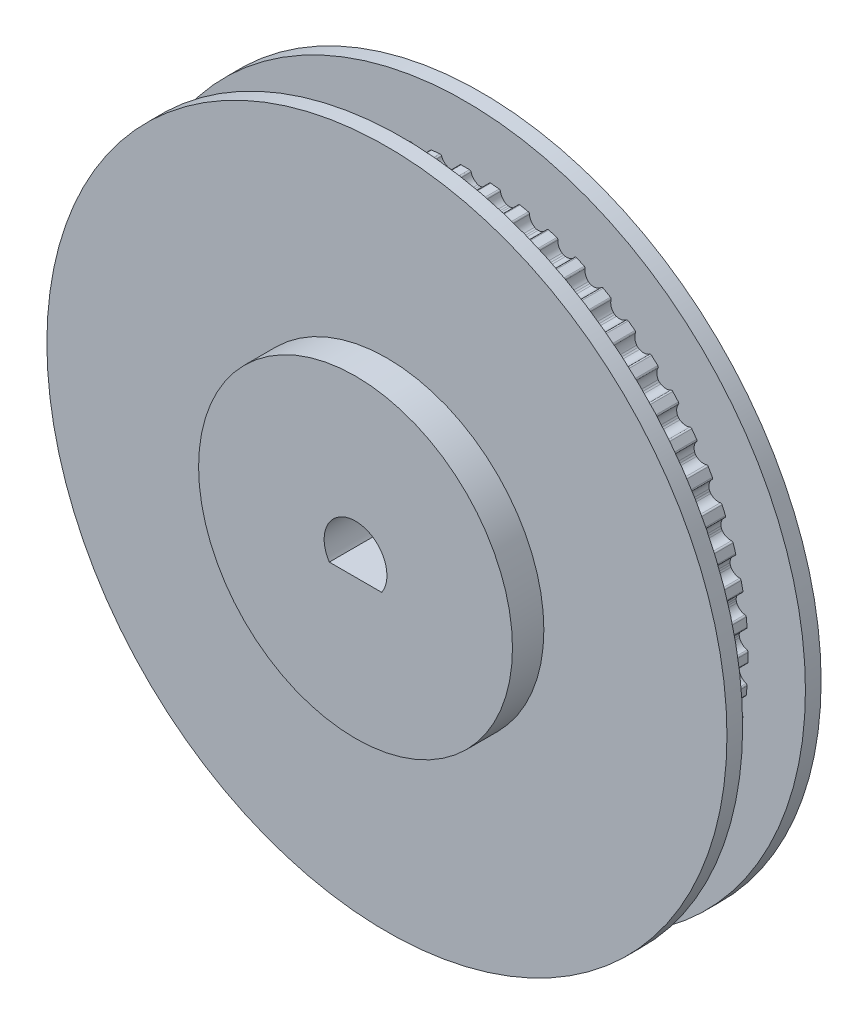
from build123d import *

# Parameters (mm, degrees)
SKETCH2_R           = 27.695
BOSS_EXTRUDE1_DEPTH = 3
SKETCH3_R           = 27.695
CUT_EXTRUDE5_DEPTH  = 40.623554232
SKETCH4_R           = 32.5
BOSS_EXTRUDE2_DEPTH = 1.5
BOSS_EXTRUDE3_START = 1.5
SKETCH5_R           = 32.5
BOSS_EXTRUDE3_DEPTH = 1.5
SKETCH6_R           = 15
BOSS_EXTRUDE4_DEPTH = 3
CUT_EXTRUDE6_DEPTH  = 48.502631506
CUT_EXTRUDE7_REACH  = 75.058
SKETCH8_R           = 1.5


with BuildPart() as part:
    # Sketch2 → Boss-Extrude1 (new, symmetric)
    with BuildSketch(Plane.XY):
        Circle(SKETCH2_R)
    extrude(amount=BOSS_EXTRUDE1_DEPTH, both=True)

    # Sketch3 → Cut-Extrude5 (cut, through all)
    with BuildSketch(Plane.XY.offset(3)):
        Circle(SKETCH3_R)
        with BuildLine():
            Line((2.427877919, 26.926424266), (3.223495435, 26.842801495))
            ThreePointArc((3.223495435, 26.842801495), (3.312543817, 26.801010915), (3.356554343, 26.713038531))
            ThreePointArc((3.356554343, 26.713038531), (3.543312083, 26.248968735), (3.931469889, 25.933417238))
            ThreePointArc((3.931469889, 25.933417238), (4.013941141, 25.903512456), (4.100094244, 25.886976241))
            ThreePointArc((4.100094244, 25.886976241), (4.187140685, 25.876080343), (4.274816593, 25.879036463))
            ThreePointArc((4.274816593, 25.879036463), (4.741487378, 26.059196411), (5.062509997, 26.442841699))
            ThreePointArc((5.062509997, 26.442841699), (5.131551457, 26.512908409), (5.2291555, 26.525136148))
            Line((5.2291555, 26.525136148), (6.01167358, 26.358806796))
            ThreePointArc((6.01167358, 26.358806796), (6.09586584, 26.307937059), (6.130439654, 26.215846244))
            ThreePointArc((6.130439654, 26.215846244), (6.267665813, 25.734797171), (6.620713136, 25.380400759))
            ThreePointArc((6.620713136, 25.380400759), (6.699606702, 25.342039205), (6.783559343, 25.316588126))
            ThreePointArc((6.783559343, 25.316588126), (6.868990004, 25.296653086), (6.956494612, 25.290428384))
            ThreePointArc((6.956494612, 25.290428384), (7.439440769, 25.420821017), (7.798806645, 25.768808656))
            ThreePointArc((7.798806645, 25.768808656), (7.874793854, 25.831274734), (7.973141358, 25.833233089))
            Line((7.973141358, 25.833233089), (8.733986571, 25.586019493))
            ThreePointArc((8.733986571, 25.586019493), (8.812400282, 25.526627938), (8.837158585, 25.431427659))
            ThreePointArc((8.837158585, 25.431427659), (8.923349684, 24.938669783), (9.237418465, 24.549311298))
            ThreePointArc((9.237418465, 24.549311298), (9.311869969, 24.50291327), (9.392702348, 24.468826174))
            ThreePointArc((9.392702348, 24.468826174), (9.47558123, 24.440070404), (9.561955821, 24.424733079))
            ThreePointArc((9.561955821, 24.424733079), (10.05588609, 24.503929789), (10.449657935, 24.812447152))
            ThreePointArc((10.449657935, 24.812447152), (10.531758361, 24.866628208), (10.629771812, 24.858295721))
            Line((10.629771812, 24.858295721), (11.360608178, 24.532906407))
            ThreePointArc((11.360608178, 24.532906407), (11.432384222, 24.46564374), (11.447055758, 24.36837703))
            ThreePointArc((11.447055758, 24.36837703), (11.48126747, 23.869309111), (11.752916705, 23.449254446))
            ThreePointArc((11.752916705, 23.449254446), (11.822110441, 23.395328289), (11.898936939, 23.352978641))
            ThreePointArc((11.898936939, 23.352978641), (11.978356007, 23.315717197), (12.062654241, 23.291435288))
            ThreePointArc((12.062654241, 23.291435288), (12.562157019, 23.318568378), (12.986020586, 23.584235284))
            ThreePointArc((12.986020586, 23.584235284), (13.07333472, 23.6295377), (13.169940261, 23.611005664))
            Line((13.169940261, 23.611005664), (13.862760584, 23.211005664))
            ThreePointArc((13.862760584, 23.211005664), (13.927112568, 23.13660883), (13.931536592, 23.038341364))
            ThreePointArc((13.931536592, 23.038341364), (13.913394086, 22.538431294), (14.139647529, 22.092282654))
            ThreePointArc((14.139647529, 22.092282654), (14.202825397, 22.031419196), (14.274804288, 21.981270988))
            ThreePointArc((14.274804288, 21.981270988), (14.349893408, 21.935912113), (14.431191697, 21.902951658))
            ThreePointArc((14.431191697, 21.902951658), (14.930794326, 21.877723852), (15.380105678, 22.0976296))
            ThreePointArc((15.380105678, 22.0976296), (15.471676888, 22.133557032), (15.565816088, 22.105028488))
            Line((15.565816088, 22.105028488), (16.213029684, 21.634800286))
            ThreePointArc((16.213029684, 21.634800286), (16.269252554, 21.554084391), (16.263380596, 21.455892809))
            ThreePointArc((16.263380596, 21.455892809), (16.193082645, 20.960617706), (16.371461417, 20.493263191))
            ThreePointArc((16.371461417, 20.493263191), (16.427931225, 20.426129263), (16.494273893, 20.36873193))
            ThreePointArc((16.494273893, 20.36873193), (16.564210374, 20.315772585), (16.641617997, 20.274494706))
            ThreePointArc((16.641617997, 20.274494706), (17.135846727, 20.197182405), (17.605683114, 20.368917661))
            ThreePointArc((17.605683114, 20.368917661), (17.700508127, 20.395076482), (17.791149577, 20.356863994))
            Line((17.791149577, 20.356863994), (18.385665438, 19.821559509))
            ThreePointArc((18.385665438, 19.821559509), (18.433143205, 19.735408894), (18.417039599, 19.638369002))
            ThreePointArc((18.417039599, 19.638369002), (18.295356402, 19.153155205), (18.423906147, 18.669715248))
            ThreePointArc((18.423906147, 18.669715248), (18.473049201, 18.597046384), (18.533028782, 18.533028782))
            ThreePointArc((18.533028782, 18.533028782), (18.597046384, 18.473049201), (18.669715248, 18.423906147))
            ThreePointArc((18.669715248, 18.423906147), (19.153155205, 18.295356402), (19.638369002, 18.417039599))
            ThreePointArc((19.638369002, 18.417039599), (19.735408894, 18.433143205), (19.821559509, 18.385665438))
            Line((19.821559509, 18.385665438), (20.356863994, 17.791149577))
            ThreePointArc((20.356863994, 17.791149577), (20.395076482, 17.700508127), (20.368917661, 17.605683114))
            ThreePointArc((20.368917661, 17.605683114), (20.197182405, 17.135846727), (20.274494706, 16.641617997))
            ThreePointArc((20.274494706, 16.641617997), (20.315772585, 16.564210374), (20.36873193, 16.494273893))
            ThreePointArc((20.36873193, 16.494273893), (20.426129263, 16.427931225), (20.493263191, 16.371461417))
            ThreePointArc((20.493263191, 16.371461417), (20.960617706, 16.193082645), (21.455892809, 16.263380596))
            ThreePointArc((21.455892809, 16.263380596), (21.554084391, 16.269252554), (21.634800286, 16.213029684))
            Line((21.634800286, 16.213029684), (22.105028488, 15.565816088))
            ThreePointArc((22.105028488, 15.565816088), (22.133557032, 15.471676888), (22.0976296, 15.380105678))
            ThreePointArc((22.0976296, 15.380105678), (21.877723852, 14.930794326), (21.902951658, 14.431191697))
            ThreePointArc((21.902951658, 14.431191697), (21.935912113, 14.349893408), (21.981270988, 14.274804288))
            ThreePointArc((21.981270988, 14.274804288), (22.031419196, 14.202825397), (22.092282654, 14.139647529))
            ThreePointArc((22.092282654, 14.139647529), (22.538431294, 13.913394086), (23.038341364, 13.931536592))
            ThreePointArc((23.038341364, 13.931536592), (23.13660883, 13.927112568), (23.211005664, 13.862760584))
            Line((23.211005664, 13.862760584), (23.611005664, 13.169940261))
            ThreePointArc((23.611005664, 13.169940261), (23.6295377, 13.07333472), (23.584235284, 12.986020586))
            ThreePointArc((23.584235284, 12.986020586), (23.318568378, 12.562157019), (23.291435288, 12.062654241))
            ThreePointArc((23.291435288, 12.062654241), (23.315717197, 11.978356007), (23.352978641, 11.898936939))
            ThreePointArc((23.352978641, 11.898936939), (23.395328289, 11.822110441), (23.449254446, 11.752916705))
            ThreePointArc((23.449254446, 11.752916705), (23.869309111, 11.48126747), (24.36837703, 11.447055758))
            ThreePointArc((24.36837703, 11.447055758), (24.46564374, 11.432384222), (24.532906407, 11.360608178))
            Line((24.532906407, 11.360608178), (24.858295721, 10.629771812))
            ThreePointArc((24.858295721, 10.629771812), (24.866628208, 10.531758361), (24.812447152, 10.449657935))
            ThreePointArc((24.812447152, 10.449657935), (24.503929789, 10.05588609), (24.424733079, 9.561955821))
            ThreePointArc((24.424733079, 9.561955821), (24.440070404, 9.47558123), (24.468826174, 9.392702348))
            ThreePointArc((24.468826174, 9.392702348), (24.50291327, 9.311869969), (24.549311298, 9.237418465))
            ThreePointArc((24.549311298, 9.237418465), (24.938669783, 8.923349684), (25.431427659, 8.837158585))
            ThreePointArc((25.431427659, 8.837158585), (25.526627938, 8.812400282), (25.586019493, 8.733986571))
            Line((25.586019493, 8.733986571), (25.833233089, 7.973141358))
            ThreePointArc((25.833233089, 7.973141358), (25.831274734, 7.874793854), (25.768808656, 7.798806645))
            ThreePointArc((25.768808656, 7.798806645), (25.420821017, 7.439440769), (25.290428384, 6.956494612))
            ThreePointArc((25.290428384, 6.956494612), (25.296653086, 6.868990004), (25.316588126, 6.783559343))
            ThreePointArc((25.316588126, 6.783559343), (25.342039205, 6.699606702), (25.380400759, 6.620713136))
            ThreePointArc((25.380400759, 6.620713136), (25.734797171, 6.267665813), (26.215846244, 6.130439654))
            ThreePointArc((26.215846244, 6.130439654), (26.307937059, 6.09586584), (26.358806796, 6.01167358))
            Line((26.358806796, 6.01167358), (26.525136148, 5.2291555))
            ThreePointArc((26.525136148, 5.2291555), (26.512908409, 5.131551457), (26.442841699, 5.062509997))
            ThreePointArc((26.442841699, 5.062509997), (26.059196411, 4.741487378), (25.879036463, 4.274816593))
            ThreePointArc((25.879036463, 4.274816593), (25.876080343, 4.187140685), (25.886976241, 4.100094244))
            ThreePointArc((25.886976241, 4.100094244), (25.903512456, 4.013941141), (25.933417238, 3.931469889))
            ThreePointArc((25.933417238, 3.931469889), (26.248968735, 3.543312083), (26.713038531, 3.356554343))
            ThreePointArc((26.713038531, 3.356554343), (26.801010915, 3.312543817), (26.842801495, 3.223495435))
            Line((26.842801495, 3.223495435), (26.926424266, 2.427877919))
            ThreePointArc((26.926424266, 2.427877919), (26.90406111, 2.332086708), (26.827161436, 2.27074743))
            ThreePointArc((26.827161436, 2.27074743), (26.412061796, 1.991585259), (26.184108402, 1.546302788))
            ThreePointArc((26.184108402, 1.546302788), (26.172003849, 1.459416176), (26.173741227, 1.371707653))
            ThreePointArc((26.173741227, 1.371707653), (26.181181403, 1.284298001), (26.202301771, 1.199152634))
            ThreePointArc((26.202301771, 1.199152634), (26.475551105, 0.780137084), (26.917557178, 0.54589392))
            ThreePointArc((26.917557178, 0.54589392), (27.000447288, 0.49292887), (27.032700844, 0.4))
            Line((27.032700844, 0.4), (27.032700844, -0.4))
            ThreePointArc((27.032700844, -0.4), (27.000447288, -0.49292887), (26.917557178, -0.54589392))
            ThreePointArc((26.917557178, -0.54589392), (26.475551105, -0.780137084), (26.202301771, -1.199152634))
            ThreePointArc((26.202301771, -1.199152634), (26.181181403, -1.284298001), (26.173741227, -1.371707653))
            ThreePointArc((26.173741227, -1.371707653), (26.172003849, -1.459416176), (26.184108402, -1.546302788))
            ThreePointArc((26.184108402, -1.546302788), (26.412061796, -1.991585259), (26.827161436, -2.27074743))
            ThreePointArc((26.827161436, -2.27074743), (26.90406111, -2.332086708), (26.926424266, -2.427877919))
            Line((26.926424266, -2.427877919), (26.842801495, -3.223495435))
            ThreePointArc((26.842801495, -3.223495435), (26.801010915, -3.312543817), (26.713038531, -3.356554343))
            ThreePointArc((26.713038531, -3.356554343), (26.248968735, -3.543312083), (25.933417238, -3.931469889))
            ThreePointArc((25.933417238, -3.931469889), (25.903512456, -4.013941141), (25.886976241, -4.100094244))
            ThreePointArc((25.886976241, -4.100094244), (25.876080343, -4.187140685), (25.879036463, -4.274816593))
            ThreePointArc((25.879036463, -4.274816593), (26.059196411, -4.741487378), (26.442841699, -5.062509997))
            ThreePointArc((26.442841699, -5.062509997), (26.512908409, -5.131551457), (26.525136148, -5.2291555))
            Line((26.525136148, -5.2291555), (26.358806796, -6.01167358))
            ThreePointArc((26.358806796, -6.01167358), (26.307937059, -6.09586584), (26.215846244, -6.130439654))
            ThreePointArc((26.215846244, -6.130439654), (25.734797171, -6.267665813), (25.380400759, -6.620713136))
            ThreePointArc((25.380400759, -6.620713136), (25.342039205, -6.699606702), (25.316588126, -6.783559343))
            ThreePointArc((25.316588126, -6.783559343), (25.296653086, -6.868990004), (25.290428384, -6.956494612))
            ThreePointArc((25.290428384, -6.956494612), (25.420821017, -7.439440769), (25.768808656, -7.798806645))
            ThreePointArc((25.768808656, -7.798806645), (25.831274734, -7.874793854), (25.833233089, -7.973141358))
            Line((25.833233089, -7.973141358), (25.586019493, -8.733986571))
            ThreePointArc((25.586019493, -8.733986571), (25.526627938, -8.812400282), (25.431427659, -8.837158585))
            ThreePointArc((25.431427659, -8.837158585), (24.938669783, -8.923349684), (24.549311298, -9.237418465))
            ThreePointArc((24.549311298, -9.237418465), (24.50291327, -9.311869969), (24.468826174, -9.392702348))
            ThreePointArc((24.468826174, -9.392702348), (24.440070404, -9.47558123), (24.424733079, -9.561955821))
            ThreePointArc((24.424733079, -9.561955821), (24.503929789, -10.05588609), (24.812447152, -10.449657935))
            ThreePointArc((24.812447152, -10.449657935), (24.866628208, -10.531758361), (24.858295721, -10.629771812))
            Line((24.858295721, -10.629771812), (24.532906407, -11.360608178))
            ThreePointArc((24.532906407, -11.360608178), (24.46564374, -11.432384222), (24.36837703, -11.447055758))
            ThreePointArc((24.36837703, -11.447055758), (23.869309111, -11.48126747), (23.449254446, -11.752916705))
            ThreePointArc((23.449254446, -11.752916705), (23.395328289, -11.822110441), (23.352978641, -11.898936939))
            ThreePointArc((23.352978641, -11.898936939), (23.315717197, -11.978356007), (23.291435288, -12.062654241))
            ThreePointArc((23.291435288, -12.062654241), (23.318568378, -12.562157019), (23.584235284, -12.986020586))
            ThreePointArc((23.584235284, -12.986020586), (23.6295377, -13.07333472), (23.611005664, -13.169940261))
            Line((23.611005664, -13.169940261), (23.211005664, -13.862760584))
            ThreePointArc((23.211005664, -13.862760584), (23.13660883, -13.927112568), (23.038341364, -13.931536592))
            ThreePointArc((23.038341364, -13.931536592), (22.538431294, -13.913394086), (22.092282654, -14.139647529))
            ThreePointArc((22.092282654, -14.139647529), (22.031419196, -14.202825397), (21.981270988, -14.274804288))
            ThreePointArc((21.981270988, -14.274804288), (21.935912113, -14.349893408), (21.902951658, -14.431191697))
            ThreePointArc((21.902951658, -14.431191697), (21.877723852, -14.930794326), (22.0976296, -15.380105678))
            ThreePointArc((22.0976296, -15.380105678), (22.133557032, -15.471676888), (22.105028488, -15.565816088))
            Line((22.105028488, -15.565816088), (21.634800286, -16.213029684))
            ThreePointArc((21.634800286, -16.213029684), (21.554084391, -16.269252554), (21.455892809, -16.263380596))
            ThreePointArc((21.455892809, -16.263380596), (20.960617706, -16.193082645), (20.493263191, -16.371461417))
            ThreePointArc((20.493263191, -16.371461417), (20.426129263, -16.427931225), (20.36873193, -16.494273893))
            ThreePointArc((20.36873193, -16.494273893), (20.315772585, -16.564210374), (20.274494706, -16.641617997))
            ThreePointArc((20.274494706, -16.641617997), (20.197182405, -17.135846727), (20.368917661, -17.605683114))
            ThreePointArc((20.368917661, -17.605683114), (20.395076482, -17.700508127), (20.356863994, -17.791149577))
            Line((20.356863994, -17.791149577), (19.821559509, -18.385665438))
            ThreePointArc((19.821559509, -18.385665438), (19.735408894, -18.433143205), (19.638369002, -18.417039599))
            ThreePointArc((19.638369002, -18.417039599), (19.153155205, -18.295356402), (18.669715248, -18.423906147))
            ThreePointArc((18.669715248, -18.423906147), (18.597046384, -18.473049201), (18.533028782, -18.533028782))
            ThreePointArc((18.533028782, -18.533028782), (18.473049201, -18.597046384), (18.423906147, -18.669715248))
            ThreePointArc((18.423906147, -18.669715248), (18.295356402, -19.153155205), (18.417039599, -19.638369002))
            ThreePointArc((18.417039599, -19.638369002), (18.433143205, -19.735408894), (18.385665438, -19.821559509))
            Line((18.385665438, -19.821559509), (17.791149577, -20.356863994))
            ThreePointArc((17.791149577, -20.356863994), (17.700508127, -20.395076482), (17.605683114, -20.368917661))
            ThreePointArc((17.605683114, -20.368917661), (17.135846727, -20.197182405), (16.641617997, -20.274494706))
            ThreePointArc((16.641617997, -20.274494706), (16.564210374, -20.315772585), (16.494273893, -20.36873193))
            ThreePointArc((16.494273893, -20.36873193), (16.427931225, -20.426129263), (16.371461417, -20.493263191))
            ThreePointArc((16.371461417, -20.493263191), (16.193082645, -20.960617706), (16.263380596, -21.455892809))
            ThreePointArc((16.263380596, -21.455892809), (16.269252554, -21.554084391), (16.213029684, -21.634800286))
            Line((16.213029684, -21.634800286), (15.565816088, -22.105028488))
            ThreePointArc((15.565816088, -22.105028488), (15.471676888, -22.133557032), (15.380105678, -22.0976296))
            ThreePointArc((15.380105678, -22.0976296), (14.930794326, -21.877723852), (14.431191697, -21.902951658))
            ThreePointArc((14.431191697, -21.902951658), (14.349893408, -21.935912113), (14.274804288, -21.981270988))
            ThreePointArc((14.274804288, -21.981270988), (14.202825397, -22.031419196), (14.139647529, -22.092282654))
            ThreePointArc((14.139647529, -22.092282654), (13.913394086, -22.538431294), (13.931536592, -23.038341364))
            ThreePointArc((13.931536592, -23.038341364), (13.927112568, -23.13660883), (13.862760584, -23.211005664))
            Line((13.862760584, -23.211005664), (13.169940261, -23.611005664))
            ThreePointArc((13.169940261, -23.611005664), (13.07333472, -23.6295377), (12.986020586, -23.584235284))
            ThreePointArc((12.986020586, -23.584235284), (12.562157019, -23.318568378), (12.062654241, -23.291435288))
            ThreePointArc((12.062654241, -23.291435288), (11.978356007, -23.315717197), (11.898936939, -23.352978641))
            ThreePointArc((11.898936939, -23.352978641), (11.822110441, -23.395328289), (11.752916705, -23.449254446))
            ThreePointArc((11.752916705, -23.449254446), (11.48126747, -23.869309111), (11.447055758, -24.36837703))
            ThreePointArc((11.447055758, -24.36837703), (11.432384222, -24.46564374), (11.360608178, -24.532906407))
            Line((11.360608178, -24.532906407), (10.629771812, -24.858295721))
            ThreePointArc((10.629771812, -24.858295721), (10.531758361, -24.866628208), (10.449657935, -24.812447152))
            ThreePointArc((10.449657935, -24.812447152), (10.05588609, -24.503929789), (9.561955821, -24.424733079))
            ThreePointArc((9.561955821, -24.424733079), (9.47558123, -24.440070404), (9.392702348, -24.468826174))
            ThreePointArc((9.392702348, -24.468826174), (9.311869969, -24.50291327), (9.237418465, -24.549311298))
            ThreePointArc((9.237418465, -24.549311298), (8.923349684, -24.938669783), (8.837158585, -25.431427659))
            ThreePointArc((8.837158585, -25.431427659), (8.812400282, -25.526627938), (8.733986571, -25.586019493))
            Line((8.733986571, -25.586019493), (7.973141358, -25.833233089))
            ThreePointArc((7.973141358, -25.833233089), (7.874793854, -25.831274734), (7.798806645, -25.768808656))
            ThreePointArc((7.798806645, -25.768808656), (7.439440769, -25.420821017), (6.956494612, -25.290428384))
            ThreePointArc((6.956494612, -25.290428384), (6.868990004, -25.296653086), (6.783559343, -25.316588126))
            ThreePointArc((6.783559343, -25.316588126), (6.699606702, -25.342039205), (6.620713136, -25.380400759))
            ThreePointArc((6.620713136, -25.380400759), (6.267665813, -25.734797171), (6.130439654, -26.215846244))
            ThreePointArc((6.130439654, -26.215846244), (6.09586584, -26.307937059), (6.01167358, -26.358806796))
            Line((6.01167358, -26.358806796), (5.2291555, -26.525136148))
            ThreePointArc((5.2291555, -26.525136148), (5.131551457, -26.512908409), (5.062509997, -26.442841699))
            ThreePointArc((5.062509997, -26.442841699), (4.741487378, -26.059196411), (4.274816593, -25.879036463))
            ThreePointArc((4.274816593, -25.879036463), (4.187140685, -25.876080343), (4.100094244, -25.886976241))
            ThreePointArc((4.100094244, -25.886976241), (4.013941141, -25.903512456), (3.931469889, -25.933417238))
            ThreePointArc((3.931469889, -25.933417238), (3.543312083, -26.248968735), (3.356554343, -26.713038531))
            ThreePointArc((3.356554343, -26.713038531), (3.312543817, -26.801010915), (3.223495435, -26.842801495))
            Line((3.223495435, -26.842801495), (2.427877919, -26.926424266))
            ThreePointArc((2.427877919, -26.926424266), (2.332086708, -26.90406111), (2.27074743, -26.827161436))
            ThreePointArc((2.27074743, -26.827161436), (1.991585259, -26.412061796), (1.546302788, -26.184108402))
            ThreePointArc((1.546302788, -26.184108402), (1.459416176, -26.172003849), (1.371707653, -26.173741227))
            ThreePointArc((1.371707653, -26.173741227), (1.284298001, -26.181181403), (1.199152634, -26.202301771))
            ThreePointArc((1.199152634, -26.202301771), (0.780137084, -26.475551105), (0.54589392, -26.917557178))
            ThreePointArc((0.54589392, -26.917557178), (0.49292887, -27.000447288), (0.4, -27.032700844))
            Line((0.4, -27.032700844), (-0.4, -27.032700844))
            ThreePointArc((-0.4, -27.032700844), (-0.49292887, -27.000447288), (-0.54589392, -26.917557178))
            ThreePointArc((-0.54589392, -26.917557178), (-0.780137084, -26.475551105), (-1.199152634, -26.202301771))
            ThreePointArc((-1.199152634, -26.202301771), (-1.284298001, -26.181181403), (-1.371707653, -26.173741227))
            ThreePointArc((-1.371707653, -26.173741227), (-1.459416176, -26.172003849), (-1.546302788, -26.184108402))
            ThreePointArc((-1.546302788, -26.184108402), (-1.991585259, -26.412061796), (-2.27074743, -26.827161436))
            ThreePointArc((-2.27074743, -26.827161436), (-2.332086708, -26.90406111), (-2.427877919, -26.926424266))
            Line((-2.427877919, -26.926424266), (-3.223495435, -26.842801495))
            ThreePointArc((-3.223495435, -26.842801495), (-3.312543817, -26.801010915), (-3.356554343, -26.713038531))
            ThreePointArc((-3.356554343, -26.713038531), (-3.543312083, -26.248968735), (-3.931469889, -25.933417238))
            ThreePointArc((-3.931469889, -25.933417238), (-4.013941141, -25.903512456), (-4.100094244, -25.886976241))
            ThreePointArc((-4.100094244, -25.886976241), (-4.187140685, -25.876080343), (-4.274816593, -25.879036463))
            ThreePointArc((-4.274816593, -25.879036463), (-4.741487378, -26.059196411), (-5.062509997, -26.442841699))
            ThreePointArc((-5.062509997, -26.442841699), (-5.131551457, -26.512908409), (-5.2291555, -26.525136148))
            Line((-5.2291555, -26.525136148), (-6.01167358, -26.358806796))
            ThreePointArc((-6.01167358, -26.358806796), (-6.09586584, -26.307937059), (-6.130439654, -26.215846244))
            ThreePointArc((-6.130439654, -26.215846244), (-6.267665813, -25.734797171), (-6.620713136, -25.380400759))
            ThreePointArc((-6.620713136, -25.380400759), (-6.699606702, -25.342039205), (-6.783559343, -25.316588126))
            ThreePointArc((-6.783559343, -25.316588126), (-6.868990004, -25.296653086), (-6.956494612, -25.290428384))
            ThreePointArc((-6.956494612, -25.290428384), (-7.439440769, -25.420821017), (-7.798806645, -25.768808656))
            ThreePointArc((-7.798806645, -25.768808656), (-7.874793854, -25.831274734), (-7.973141358, -25.833233089))
            Line((-7.973141358, -25.833233089), (-8.733986571, -25.586019493))
            ThreePointArc((-8.733986571, -25.586019493), (-8.812400282, -25.526627938), (-8.837158585, -25.431427659))
            ThreePointArc((-8.837158585, -25.431427659), (-8.923349684, -24.938669783), (-9.237418465, -24.549311298))
            ThreePointArc((-9.237418465, -24.549311298), (-9.311869969, -24.50291327), (-9.392702348, -24.468826174))
            ThreePointArc((-9.392702348, -24.468826174), (-9.47558123, -24.440070404), (-9.561955821, -24.424733079))
            ThreePointArc((-9.561955821, -24.424733079), (-10.05588609, -24.503929789), (-10.449657935, -24.812447152))
            ThreePointArc((-10.449657935, -24.812447152), (-10.531758361, -24.866628208), (-10.629771812, -24.858295721))
            Line((-10.629771812, -24.858295721), (-11.360608178, -24.532906407))
            ThreePointArc((-11.360608178, -24.532906407), (-11.432384222, -24.46564374), (-11.447055758, -24.36837703))
            ThreePointArc((-11.447055758, -24.36837703), (-11.48126747, -23.869309111), (-11.752916705, -23.449254446))
            ThreePointArc((-11.752916705, -23.449254446), (-11.822110441, -23.395328289), (-11.898936939, -23.352978641))
            ThreePointArc((-11.898936939, -23.352978641), (-11.978356007, -23.315717197), (-12.062654241, -23.291435288))
            ThreePointArc((-12.062654241, -23.291435288), (-12.562157019, -23.318568378), (-12.986020586, -23.584235284))
            ThreePointArc((-12.986020586, -23.584235284), (-13.07333472, -23.6295377), (-13.169940261, -23.611005664))
            Line((-13.169940261, -23.611005664), (-13.862760584, -23.211005664))
            ThreePointArc((-13.862760584, -23.211005664), (-13.927112568, -23.13660883), (-13.931536592, -23.038341364))
            ThreePointArc((-13.931536592, -23.038341364), (-13.913394086, -22.538431294), (-14.139647529, -22.092282654))
            ThreePointArc((-14.139647529, -22.092282654), (-14.202825397, -22.031419196), (-14.274804288, -21.981270988))
            ThreePointArc((-14.274804288, -21.981270988), (-14.349893408, -21.935912113), (-14.431191697, -21.902951658))
            ThreePointArc((-14.431191697, -21.902951658), (-14.930794326, -21.877723852), (-15.380105678, -22.0976296))
            ThreePointArc((-15.380105678, -22.0976296), (-15.471676888, -22.133557032), (-15.565816088, -22.105028488))
            Line((-15.565816088, -22.105028488), (-16.213029684, -21.634800286))
            ThreePointArc((-16.213029684, -21.634800286), (-16.269252554, -21.554084391), (-16.263380596, -21.455892809))
            ThreePointArc((-16.263380596, -21.455892809), (-16.193082645, -20.960617706), (-16.371461417, -20.493263191))
            ThreePointArc((-16.371461417, -20.493263191), (-16.427931225, -20.426129263), (-16.494273893, -20.36873193))
            ThreePointArc((-16.494273893, -20.36873193), (-16.564210374, -20.315772585), (-16.641617997, -20.274494706))
            ThreePointArc((-16.641617997, -20.274494706), (-17.135846727, -20.197182405), (-17.605683114, -20.368917661))
            ThreePointArc((-17.605683114, -20.368917661), (-17.700508127, -20.395076482), (-17.791149577, -20.356863994))
            Line((-17.791149577, -20.356863994), (-18.385665438, -19.821559509))
            ThreePointArc((-18.385665438, -19.821559509), (-18.433143205, -19.735408894), (-18.417039598, -19.638369002))
            ThreePointArc((-18.417039598, -19.638369002), (-18.295356402, -19.153155205), (-18.423906147, -18.669715248))
            ThreePointArc((-18.423906147, -18.669715248), (-18.473049201, -18.597046384), (-18.533028782, -18.533028782))
            ThreePointArc((-18.533028782, -18.533028782), (-18.597046384, -18.473049201), (-18.669715248, -18.423906147))
            ThreePointArc((-18.669715248, -18.423906147), (-19.153155205, -18.295356402), (-19.638369002, -18.417039599))
            ThreePointArc((-19.638369002, -18.417039599), (-19.735408894, -18.433143205), (-19.821559509, -18.385665438))
            Line((-19.821559509, -18.385665438), (-20.356863994, -17.791149577))
            ThreePointArc((-20.356863994, -17.791149577), (-20.395076482, -17.700508127), (-20.368917661, -17.605683114))
            ThreePointArc((-20.368917661, -17.605683114), (-20.197182405, -17.135846727), (-20.274494706, -16.641617997))
            ThreePointArc((-20.274494706, -16.641617997), (-20.315772585, -16.564210374), (-20.36873193, -16.494273893))
            ThreePointArc((-20.36873193, -16.494273893), (-20.426129263, -16.427931225), (-20.493263191, -16.371461417))
            ThreePointArc((-20.493263191, -16.371461417), (-20.960617706, -16.193082645), (-21.455892809, -16.263380596))
            ThreePointArc((-21.455892809, -16.263380596), (-21.554084391, -16.269252554), (-21.634800286, -16.213029684))
            Line((-21.634800286, -16.213029684), (-22.105028488, -15.565816088))
            ThreePointArc((-22.105028488, -15.565816088), (-22.133557032, -15.471676888), (-22.0976296, -15.380105678))
            ThreePointArc((-22.0976296, -15.380105678), (-21.877723852, -14.930794326), (-21.902951658, -14.431191697))
            ThreePointArc((-21.902951658, -14.431191697), (-21.935912113, -14.349893408), (-21.981270988, -14.274804288))
            ThreePointArc((-21.981270988, -14.274804288), (-22.031419196, -14.202825397), (-22.092282654, -14.139647529))
            ThreePointArc((-22.092282654, -14.139647529), (-22.538431294, -13.913394086), (-23.038341364, -13.931536592))
            ThreePointArc((-23.038341364, -13.931536592), (-23.13660883, -13.927112568), (-23.211005664, -13.862760584))
            Line((-23.211005664, -13.862760584), (-23.611005664, -13.169940261))
            ThreePointArc((-23.611005664, -13.169940261), (-23.6295377, -13.07333472), (-23.584235284, -12.986020586))
            ThreePointArc((-23.584235284, -12.986020586), (-23.318568378, -12.562157019), (-23.291435288, -12.062654241))
            ThreePointArc((-23.291435288, -12.062654241), (-23.315717197, -11.978356007), (-23.352978641, -11.898936939))
            ThreePointArc((-23.352978641, -11.898936939), (-23.395328289, -11.822110441), (-23.449254446, -11.752916705))
            ThreePointArc((-23.449254446, -11.752916705), (-23.869309111, -11.48126747), (-24.36837703, -11.447055758))
            ThreePointArc((-24.36837703, -11.447055758), (-24.46564374, -11.432384222), (-24.532906407, -11.360608178))
            Line((-24.532906407, -11.360608178), (-24.858295721, -10.629771812))
            ThreePointArc((-24.858295721, -10.629771812), (-24.866628208, -10.531758361), (-24.812447152, -10.449657935))
            ThreePointArc((-24.812447152, -10.449657935), (-24.503929789, -10.05588609), (-24.424733079, -9.561955821))
            ThreePointArc((-24.424733079, -9.561955821), (-24.440070404, -9.47558123), (-24.468826174, -9.392702348))
            ThreePointArc((-24.468826174, -9.392702348), (-24.50291327, -9.311869969), (-24.549311298, -9.237418465))
            ThreePointArc((-24.549311298, -9.237418465), (-24.938669783, -8.923349684), (-25.431427659, -8.837158585))
            ThreePointArc((-25.431427659, -8.837158585), (-25.526627938, -8.812400282), (-25.586019493, -8.733986571))
            Line((-25.586019493, -8.733986571), (-25.833233089, -7.973141358))
            ThreePointArc((-25.833233089, -7.973141358), (-25.831274734, -7.874793854), (-25.768808656, -7.798806645))
            ThreePointArc((-25.768808656, -7.798806645), (-25.420821017, -7.439440769), (-25.290428384, -6.956494612))
            ThreePointArc((-25.290428384, -6.956494612), (-25.296653086, -6.868990004), (-25.316588126, -6.783559343))
            ThreePointArc((-25.316588126, -6.783559343), (-25.342039205, -6.699606702), (-25.380400759, -6.620713136))
            ThreePointArc((-25.380400759, -6.620713136), (-25.734797171, -6.267665813), (-26.215846244, -6.130439654))
            ThreePointArc((-26.215846244, -6.130439654), (-26.307937059, -6.09586584), (-26.358806796, -6.01167358))
            Line((-26.358806796, -6.01167358), (-26.525136148, -5.2291555))
            ThreePointArc((-26.525136148, -5.2291555), (-26.512908409, -5.131551457), (-26.442841699, -5.062509997))
            ThreePointArc((-26.442841699, -5.062509997), (-26.059196411, -4.741487378), (-25.879036463, -4.274816593))
            ThreePointArc((-25.879036463, -4.274816593), (-25.876080343, -4.187140685), (-25.886976241, -4.100094244))
            ThreePointArc((-25.886976241, -4.100094244), (-25.903512456, -4.013941141), (-25.933417238, -3.931469889))
            ThreePointArc((-25.933417238, -3.931469889), (-26.248968735, -3.543312083), (-26.713038531, -3.356554343))
            ThreePointArc((-26.713038531, -3.356554343), (-26.801010915, -3.312543817), (-26.842801495, -3.223495435))
            Line((-26.842801495, -3.223495435), (-26.926424266, -2.427877919))
            ThreePointArc((-26.926424266, -2.427877919), (-26.90406111, -2.332086708), (-26.827161436, -2.27074743))
            ThreePointArc((-26.827161436, -2.27074743), (-26.412061796, -1.991585259), (-26.184108402, -1.546302788))
            ThreePointArc((-26.184108402, -1.546302788), (-26.172003849, -1.459416176), (-26.173741227, -1.371707653))
            ThreePointArc((-26.173741227, -1.371707653), (-26.181181403, -1.284298001), (-26.202301771, -1.199152634))
            ThreePointArc((-26.202301771, -1.199152634), (-26.475551105, -0.780137084), (-26.917557178, -0.54589392))
            ThreePointArc((-26.917557178, -0.54589392), (-27.000447288, -0.49292887), (-27.032700844, -0.4))
            Line((-27.032700844, -0.4), (-27.032700844, 0.4))
            ThreePointArc((-27.032700844, 0.4), (-27.000447288, 0.49292887), (-26.917557178, 0.54589392))
            ThreePointArc((-26.917557178, 0.54589392), (-26.475551105, 0.780137084), (-26.202301771, 1.199152634))
            ThreePointArc((-26.202301771, 1.199152634), (-26.181181403, 1.284298001), (-26.173741227, 1.371707653))
            ThreePointArc((-26.173741227, 1.371707653), (-26.172003849, 1.459416176), (-26.184108402, 1.546302788))
            ThreePointArc((-26.184108402, 1.546302788), (-26.412061796, 1.991585259), (-26.827161436, 2.27074743))
            ThreePointArc((-26.827161436, 2.27074743), (-26.90406111, 2.332086708), (-26.926424266, 2.427877919))
            Line((-26.926424266, 2.427877919), (-26.842801495, 3.223495435))
            ThreePointArc((-26.842801495, 3.223495435), (-26.801010915, 3.312543817), (-26.713038531, 3.356554343))
            ThreePointArc((-26.713038531, 3.356554343), (-26.248968735, 3.543312083), (-25.933417238, 3.931469889))
            ThreePointArc((-25.933417238, 3.931469889), (-25.903512456, 4.013941141), (-25.886976241, 4.100094244))
            ThreePointArc((-25.886976241, 4.100094244), (-25.876080343, 4.187140685), (-25.879036463, 4.274816593))
            ThreePointArc((-25.879036463, 4.274816593), (-26.059196411, 4.741487378), (-26.442841699, 5.062509997))
            ThreePointArc((-26.442841699, 5.062509997), (-26.512908409, 5.131551457), (-26.525136148, 5.2291555))
            Line((-26.525136148, 5.2291555), (-26.358806796, 6.01167358))
            ThreePointArc((-26.358806796, 6.01167358), (-26.307937059, 6.09586584), (-26.215846244, 6.130439654))
            ThreePointArc((-26.215846244, 6.130439654), (-25.734797171, 6.267665813), (-25.380400759, 6.620713136))
            ThreePointArc((-25.380400759, 6.620713136), (-25.342039205, 6.699606702), (-25.316588126, 6.783559343))
            ThreePointArc((-25.316588126, 6.783559343), (-25.296653086, 6.868990004), (-25.290428384, 6.956494612))
            ThreePointArc((-25.290428384, 6.956494612), (-25.420821017, 7.439440769), (-25.768808656, 7.798806645))
            ThreePointArc((-25.768808656, 7.798806645), (-25.831274734, 7.874793854), (-25.833233089, 7.973141358))
            Line((-25.833233089, 7.973141358), (-25.586019493, 8.733986571))
            ThreePointArc((-25.586019493, 8.733986571), (-25.526627938, 8.812400282), (-25.431427659, 8.837158585))
            ThreePointArc((-25.431427659, 8.837158585), (-24.938669783, 8.923349684), (-24.549311298, 9.237418465))
            ThreePointArc((-24.549311298, 9.237418465), (-24.50291327, 9.311869969), (-24.468826174, 9.392702348))
            ThreePointArc((-24.468826174, 9.392702348), (-24.440070404, 9.47558123), (-24.424733079, 9.561955821))
            ThreePointArc((-24.424733079, 9.561955821), (-24.503929789, 10.05588609), (-24.812447152, 10.449657935))
            ThreePointArc((-24.812447152, 10.449657935), (-24.866628208, 10.531758361), (-24.858295721, 10.629771812))
            Line((-24.858295721, 10.629771812), (-24.532906407, 11.360608178))
            ThreePointArc((-24.532906407, 11.360608178), (-24.46564374, 11.432384222), (-24.36837703, 11.447055758))
            ThreePointArc((-24.36837703, 11.447055758), (-23.869309111, 11.48126747), (-23.449254446, 11.752916705))
            ThreePointArc((-23.449254446, 11.752916705), (-23.395328289, 11.822110441), (-23.352978641, 11.898936939))
            ThreePointArc((-23.352978641, 11.898936939), (-23.315717197, 11.978356007), (-23.291435288, 12.062654241))
            ThreePointArc((-23.291435288, 12.062654241), (-23.318568378, 12.562157019), (-23.584235284, 12.986020586))
            ThreePointArc((-23.584235284, 12.986020586), (-23.6295377, 13.07333472), (-23.611005664, 13.169940261))
            Line((-23.611005664, 13.169940261), (-23.211005664, 13.862760584))
            ThreePointArc((-23.211005664, 13.862760584), (-23.13660883, 13.927112568), (-23.038341364, 13.931536592))
            ThreePointArc((-23.038341364, 13.931536592), (-22.538431294, 13.913394086), (-22.092282654, 14.139647529))
            ThreePointArc((-22.092282654, 14.139647529), (-22.031419196, 14.202825397), (-21.981270988, 14.274804288))
            ThreePointArc((-21.981270988, 14.274804288), (-21.935912113, 14.349893408), (-21.902951658, 14.431191697))
            ThreePointArc((-21.902951658, 14.431191697), (-21.877723852, 14.930794326), (-22.0976296, 15.380105678))
            ThreePointArc((-22.0976296, 15.380105678), (-22.133557032, 15.471676888), (-22.105028488, 15.565816088))
            Line((-22.105028488, 15.565816088), (-21.634800286, 16.213029684))
            ThreePointArc((-21.634800286, 16.213029684), (-21.554084391, 16.269252554), (-21.455892809, 16.263380596))
            ThreePointArc((-21.455892809, 16.263380596), (-20.960617706, 16.193082645), (-20.493263191, 16.371461417))
            ThreePointArc((-20.493263191, 16.371461417), (-20.426129263, 16.427931225), (-20.36873193, 16.494273893))
            ThreePointArc((-20.36873193, 16.494273893), (-20.315772585, 16.564210374), (-20.274494706, 16.641617997))
            ThreePointArc((-20.274494706, 16.641617997), (-20.197182405, 17.135846727), (-20.368917661, 17.605683114))
            ThreePointArc((-20.368917661, 17.605683114), (-20.395076482, 17.700508127), (-20.356863994, 17.791149577))
            Line((-20.356863994, 17.791149577), (-19.821559509, 18.385665438))
            ThreePointArc((-19.821559509, 18.385665438), (-19.735408894, 18.433143205), (-19.638369002, 18.417039599))
            ThreePointArc((-19.638369002, 18.417039599), (-19.153155205, 18.295356402), (-18.669715248, 18.423906147))
            ThreePointArc((-18.669715248, 18.423906147), (-18.597046384, 18.473049201), (-18.533028782, 18.533028782))
            ThreePointArc((-18.533028782, 18.533028782), (-18.473049201, 18.597046384), (-18.423906147, 18.669715248))
            ThreePointArc((-18.423906147, 18.669715248), (-18.295356402, 19.153155205), (-18.417039599, 19.638369002))
            ThreePointArc((-18.417039599, 19.638369002), (-18.433143205, 19.735408894), (-18.385665438, 19.821559509))
            Line((-18.385665438, 19.821559509), (-17.791149577, 20.356863994))
            ThreePointArc((-17.791149577, 20.356863994), (-17.700508127, 20.395076482), (-17.605683114, 20.368917661))
            ThreePointArc((-17.605683114, 20.368917661), (-17.135846727, 20.197182405), (-16.641617997, 20.274494706))
            ThreePointArc((-16.641617997, 20.274494706), (-16.564210374, 20.315772585), (-16.494273893, 20.36873193))
            ThreePointArc((-16.494273893, 20.36873193), (-16.427931225, 20.426129263), (-16.371461417, 20.493263191))
            ThreePointArc((-16.371461417, 20.493263191), (-16.193082645, 20.960617706), (-16.263380596, 21.455892809))
            ThreePointArc((-16.263380596, 21.455892809), (-16.269252554, 21.554084391), (-16.213029684, 21.634800286))
            Line((-16.213029684, 21.634800286), (-15.565816088, 22.105028488))
            ThreePointArc((-15.565816088, 22.105028488), (-15.471676888, 22.133557032), (-15.380105678, 22.0976296))
            ThreePointArc((-15.380105678, 22.0976296), (-14.930794326, 21.877723852), (-14.431191697, 21.902951658))
            ThreePointArc((-14.431191697, 21.902951658), (-14.349893408, 21.935912113), (-14.274804288, 21.981270988))
            ThreePointArc((-14.274804288, 21.981270988), (-14.202825397, 22.031419196), (-14.139647529, 22.092282654))
            ThreePointArc((-14.139647529, 22.092282654), (-13.913394086, 22.538431294), (-13.931536592, 23.038341364))
            ThreePointArc((-13.931536592, 23.038341364), (-13.927112568, 23.13660883), (-13.862760584, 23.211005664))
            Line((-13.862760584, 23.211005664), (-13.169940261, 23.611005664))
            ThreePointArc((-13.169940261, 23.611005664), (-13.07333472, 23.6295377), (-12.986020586, 23.584235284))
            ThreePointArc((-12.986020586, 23.584235284), (-12.562157019, 23.318568378), (-12.062654241, 23.291435288))
            ThreePointArc((-12.062654241, 23.291435288), (-11.978356007, 23.315717197), (-11.898936939, 23.352978641))
            ThreePointArc((-11.898936939, 23.352978641), (-11.822110441, 23.395328289), (-11.752916705, 23.449254446))
            ThreePointArc((-11.752916705, 23.449254446), (-11.48126747, 23.869309111), (-11.447055758, 24.36837703))
            ThreePointArc((-11.447055758, 24.36837703), (-11.432384222, 24.46564374), (-11.360608178, 24.532906407))
            Line((-11.360608178, 24.532906407), (-10.629771812, 24.858295721))
            ThreePointArc((-10.629771812, 24.858295721), (-10.531758361, 24.866628208), (-10.449657935, 24.812447152))
            ThreePointArc((-10.449657935, 24.812447152), (-10.05588609, 24.503929789), (-9.561955821, 24.424733079))
            ThreePointArc((-9.561955821, 24.424733079), (-9.47558123, 24.440070404), (-9.392702348, 24.468826174))
            ThreePointArc((-9.392702348, 24.468826174), (-9.311869969, 24.50291327), (-9.237418465, 24.549311298))
            ThreePointArc((-9.237418465, 24.549311298), (-8.923349684, 24.938669783), (-8.837158585, 25.431427659))
            ThreePointArc((-8.837158585, 25.431427659), (-8.812400282, 25.526627938), (-8.733986571, 25.586019493))
            Line((-8.733986571, 25.586019493), (-7.973141358, 25.833233089))
            ThreePointArc((-7.973141358, 25.833233089), (-7.874793854, 25.831274734), (-7.798806645, 25.768808656))
            ThreePointArc((-7.798806645, 25.768808656), (-7.439440769, 25.420821017), (-6.956494612, 25.290428384))
            ThreePointArc((-6.956494612, 25.290428384), (-6.868990004, 25.296653086), (-6.783559343, 25.316588126))
            ThreePointArc((-6.783559343, 25.316588126), (-6.699606702, 25.342039205), (-6.620713136, 25.380400759))
            ThreePointArc((-6.620713136, 25.380400759), (-6.267665813, 25.734797171), (-6.130439654, 26.215846244))
            ThreePointArc((-6.130439654, 26.215846244), (-6.09586584, 26.307937059), (-6.01167358, 26.358806796))
            Line((-6.01167358, 26.358806796), (-5.2291555, 26.525136148))
            ThreePointArc((-5.2291555, 26.525136148), (-5.131551457, 26.512908409), (-5.062509997, 26.442841699))
            ThreePointArc((-5.062509997, 26.442841699), (-4.741487378, 26.059196411), (-4.274816593, 25.879036463))
            ThreePointArc((-4.274816593, 25.879036463), (-4.187140685, 25.876080343), (-4.100094244, 25.886976241))
            ThreePointArc((-4.100094244, 25.886976241), (-4.013941141, 25.903512456), (-3.931469889, 25.933417238))
            ThreePointArc((-3.931469889, 25.933417238), (-3.543312083, 26.248968735), (-3.356554343, 26.713038531))
            ThreePointArc((-3.356554343, 26.713038531), (-3.312543817, 26.801010915), (-3.223495435, 26.842801495))
            Line((-3.223495435, 26.842801495), (-2.427877919, 26.926424266))
            ThreePointArc((-2.427877919, 26.926424266), (-2.332086708, 26.90406111), (-2.27074743, 26.827161436))
            ThreePointArc((-2.27074743, 26.827161436), (-1.991585259, 26.412061796), (-1.546302788, 26.184108402))
            ThreePointArc((-1.546302788, 26.184108402), (-1.459416176, 26.172003849), (-1.371707653, 26.173741227))
            ThreePointArc((-1.371707653, 26.173741227), (-1.284298001, 26.181181403), (-1.199152634, 26.202301771))
            ThreePointArc((-1.199152634, 26.202301771), (-0.780137084, 26.475551105), (-0.54589392, 26.917557178))
            ThreePointArc((-0.54589392, 26.917557178), (-0.49292887, 27.000447288), (-0.4, 27.032700844))
            Line((-0.4, 27.032700844), (0.4, 27.032700844))
            ThreePointArc((0.4, 27.032700844), (0.49292887, 27.000447288), (0.54589392, 26.917557178))
            ThreePointArc((0.54589392, 26.917557178), (0.780137084, 26.475551105), (1.199152634, 26.202301771))
            ThreePointArc((1.199152634, 26.202301771), (1.284298001, 26.181181403), (1.371707653, 26.173741227))
            ThreePointArc((1.371707653, 26.173741227), (1.459416176, 26.172003849), (1.546302788, 26.184108402))
            ThreePointArc((1.546302788, 26.184108402), (1.991585259, 26.412061796), (2.27074743, 26.827161436))
            ThreePointArc((2.27074743, 26.827161436), (2.332086708, 26.90406111), (2.427877919, 26.926424266))
        make_face(mode=Mode.SUBTRACT)
    extrude(amount=-CUT_EXTRUDE5_DEPTH, mode=Mode.SUBTRACT)

    # Sketch4 → Boss-Extrude2 (add)
    with BuildSketch(Plane.XY.offset(3)):
        Circle(SKETCH4_R)
    extrude(amount=BOSS_EXTRUDE2_DEPTH)

    # Sketch5 → Boss-Extrude3 (add)
    with BuildSketch(Plane(origin=(0, 0, -3), x_dir=(-1, 0, 0), z_dir=(0, 0, -1)).offset(BOSS_EXTRUDE3_START)):
        Circle(SKETCH5_R)
    extrude(amount=-BOSS_EXTRUDE3_DEPTH)

    # Sketch6 → Boss-Extrude4 (add)
    with BuildSketch(Plane.XY.offset(4.5)):
        Circle(SKETCH6_R)
    extrude(amount=BOSS_EXTRUDE4_DEPTH)

    # Sketch7 → Cut-Extrude6 (cut, through all)
    with BuildSketch(Plane.XY.offset(7.5)):
        with BuildLine():
            Line((-2.505493963, -1.65), (2.505493963, -1.65))
            ThreePointArc((2.505493963, -1.65), (0, 3), (-2.505493963, -1.65))
        make_face()
    extrude(amount=-CUT_EXTRUDE6_DEPTH, mode=Mode.SUBTRACT)

    # Sketch8 → Cut-Extrude7 (cut, up to next)
    with BuildSketch(Plane(origin=(0, 32.5, 0), x_dir=(1, 0, 0), z_dir=(0, 1, 0)), mode=Mode.PRIVATE) as cut_extrude7_sk1:
        Circle(SKETCH8_R)
    cut_extrude7_tool1 = extrude(cut_extrude7_sk1.sketch, amount=-CUT_EXTRUDE7_REACH, mode=Mode.PRIVATE) & part.part
    add(cut_extrude7_tool1.solids().sort_by_distance((0, 32.5, 0))[0], mode=Mode.SUBTRACT)


solid = part.part
